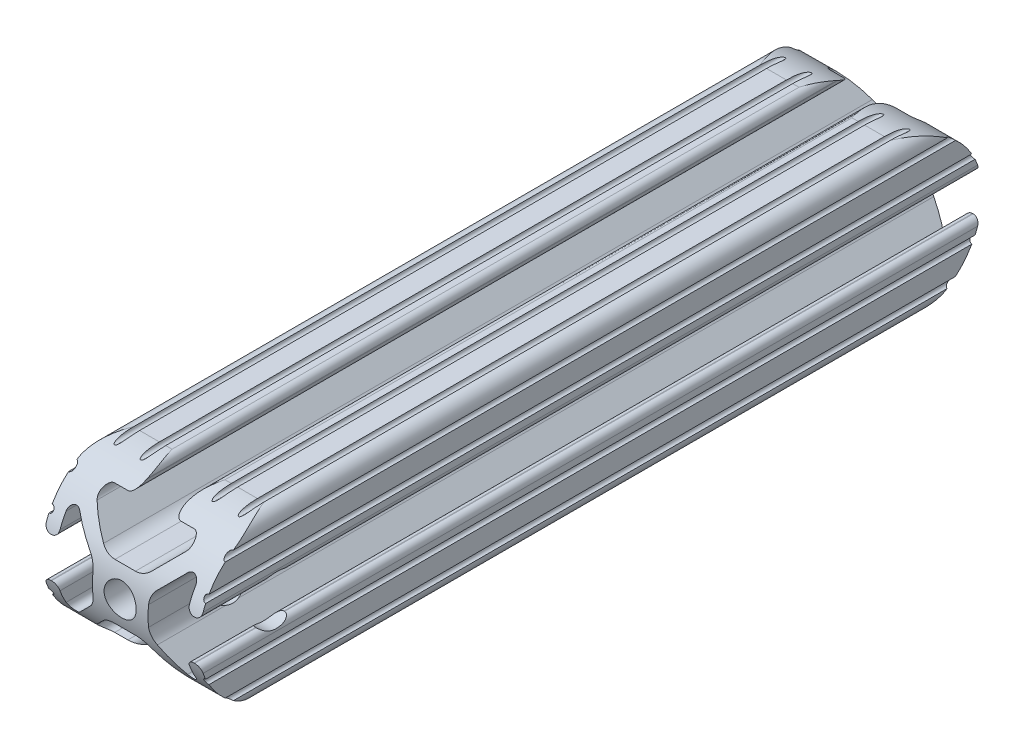
from build123d import *
from build123d.topology import SkipClean

# Parameters (mm, degrees)
SKETCH1_R           = 2.6035
BOSS_EXTRUDE1_DEPTH = 63.5
SKETCH2_R           = 3.96875
CUT_EXTRUDE1_DEPTH  = 70.560764803


with BuildPart() as part:
    # Sketch1 → Boss-Extrude1 (new, symmetric)
    with BuildSketch(Plane.XY):
        with BuildLine():
            Line((-7.179650497, -8.645192506), (-3.952270251, -5.423690499))
            ThreePointArc((-3.952270251, -5.423690499), (-2.922936451, -4.736929036), (-1.709253557, -4.4958))
            Line((-1.709253557, -4.4958), (1.709253557, -4.4958))
            ThreePointArc((1.709253557, -4.4958), (2.922936451, -4.736929036), (3.952270251, -5.423690499))
            Line((3.952270251, -5.423690499), (7.179650497, -8.645192506))
            ThreePointArc((7.179650497, -8.645192506), (7.41473083, -9.822813117), (6.416408329, -10.4902))
            Line((6.416408329, -10.4902), (4.287512407, -10.4902))
            ThreePointArc((4.287512407, -10.4902), (3.54574862, -10.79744862), (3.2385, -11.539212407))
            Line((3.2385, -11.539212407), (3.2385, -11.650987593))
            ThreePointArc((3.2385, -11.650987593), (3.54574862, -12.39275138), (4.287512407, -12.7))
            Line((4.287512407, -12.7), (5.317126718, -12.7))
            ThreePointArc((5.317126718, -12.7), (5.825126718, -12.192), (6.333126718, -12.7))
            Line((6.333126718, -12.7), (9.550443118, -12.7))
            ThreePointArc((9.550443118, -12.7), (10.058366869, -12.192000006), (10.566443095, -12.699847501))
            ThreePointArc((10.566443095, -12.699847501), (12.082537762, -12.08250727), (12.699846982, -10.566399977))
            ThreePointArc((12.699846982, -10.566399977), (12.192000006, -10.058323491), (12.7, -9.5504))
            Line((12.7, -9.5504), (12.7, -6.3330836))
            ThreePointArc((12.7, -6.3330836), (12.192, -5.8250836), (12.7, -5.3170836))
            Line((12.7, -5.3170836), (12.7, -4.287469289))
            ThreePointArc((12.7, -4.287469289), (12.39275138, -3.545705502), (11.650987593, -3.238456882))
            Line((11.650987593, -3.238456882), (11.539212407, -3.238456882))
            ThreePointArc((11.539212407, -3.238456882), (10.79744862, -3.545705502), (10.4902, -4.287469289))
            Line((10.4902, -4.287469289), (10.4902, -6.402089023))
            ThreePointArc((10.4902, -6.402089023), (9.856505071, -7.351067942), (8.737131347, -7.129408934))
            Line((8.737131347, -7.129408934), (5.441005833, -3.840816462))
            ThreePointArc((5.441005833, -3.840816462), (4.750877967, -2.809883091), (4.5085, -1.593185507))
            Line((4.5085, -1.593185507), (4.5085, 1.593185507))
            ThreePointArc((4.5085, 1.593185507), (4.750877967, 2.809883091), (5.441005833, 3.840816462))
            Line((5.441005833, 3.840816462), (8.737131347, 7.129408934))
            ThreePointArc((8.737131347, 7.129408934), (9.856505071, 7.351067942), (10.4902, 6.402089023))
            Line((10.4902, 6.402089023), (10.4902, 4.287469289))
            ThreePointArc((10.4902, 4.287469289), (10.79744862, 3.545705502), (11.539212407, 3.238456882))
            Line((11.539212407, 3.238456882), (11.650987593, 3.238456882))
            ThreePointArc((11.650987593, 3.238456882), (12.39275138, 3.545705502), (12.7, 4.287469289))
            Line((12.7, 4.287469289), (12.7, 5.3170836))
            ThreePointArc((12.7, 5.3170836), (12.192, 5.8250836), (12.7, 6.3330836))
            Line((12.7, 6.3330836), (12.7, 9.5504))
            ThreePointArc((12.7, 9.5504), (12.192000006, 10.058323491), (12.699846982, 10.566399977))
            ThreePointArc((12.699846982, 10.566399977), (12.082537762, 12.08250727), (10.566443095, 12.699847501))
            ThreePointArc((10.566443095, 12.699847501), (10.058366869, 12.192000006), (9.550443118, 12.7))
            Line((9.550443118, 12.7), (6.333126718, 12.7))
            ThreePointArc((6.333126718, 12.7), (5.825126718, 12.192), (5.317126718, 12.7))
            Line((5.317126718, 12.7), (4.287512407, 12.7))
            ThreePointArc((4.287512407, 12.7), (3.54574862, 12.39275138), (3.2385, 11.650987593))
            Line((3.2385, 11.650987593), (3.2385, 11.539212407))
            ThreePointArc((3.2385, 11.539212407), (3.54574862, 10.79744862), (4.287512407, 10.4902))
            Line((4.287512407, 10.4902), (6.476788598, 10.4902))
            ThreePointArc((6.476788598, 10.4902), (7.432222385, 9.85140422), (7.207036008, 8.724370562))
            Line((7.207036008, 8.724370562), (3.898272566, 5.423169045))
            ThreePointArc((3.898272566, 5.423169045), (2.869120213, 4.736787962), (1.655778399, 4.4958))
            Line((1.655778399, 4.4958), (-1.655778399, 4.4958))
            ThreePointArc((-1.655778399, 4.4958), (-2.869120213, 4.736787962), (-3.898272566, 5.423169045))
            Line((-3.898272566, 5.423169045), (-7.207036008, 8.724370562))
            ThreePointArc((-7.207036008, 8.724370562), (-7.432222385, 9.85140422), (-6.476788598, 10.4902))
            Line((-6.476788598, 10.4902), (-4.287512407, 10.4902))
            ThreePointArc((-4.287512407, 10.4902), (-3.54574862, 10.79744862), (-3.2385, 11.539212407))
            Line((-3.2385, 11.539212407), (-3.2385, 11.650987593))
            ThreePointArc((-3.2385, 11.650987593), (-3.54574862, 12.39275138), (-4.287512407, 12.7))
            Line((-4.287512407, 12.7), (-5.317126718, 12.7))
            ThreePointArc((-5.317126718, 12.7), (-5.825126718, 12.192), (-6.333126718, 12.7))
            Line((-6.333126718, 12.7), (-9.550443118, 12.7))
            ThreePointArc((-9.550443118, 12.7), (-10.058366869, 12.192000006), (-10.566443095, 12.699847501))
            ThreePointArc((-10.566443095, 12.699847501), (-12.082537762, 12.08250727), (-12.699846982, 10.566399977))
            ThreePointArc((-12.699846982, 10.566399977), (-12.192000006, 10.058323491), (-12.7, 9.5504))
            Line((-12.7, 9.5504), (-12.7, 6.3330836))
            ThreePointArc((-12.7, 6.3330836), (-12.192, 5.8250836), (-12.7, 5.3170836))
            Line((-12.7, 5.3170836), (-12.7, 4.287469289))
            ThreePointArc((-12.7, 4.287469289), (-12.39275138, 3.545705502), (-11.650987593, 3.238456882))
            Line((-11.650987593, 3.238456882), (-11.539212407, 3.238456882))
            ThreePointArc((-11.539212407, 3.238456882), (-10.79744862, 3.545705502), (-10.4902, 4.287469289))
            Line((-10.4902, 4.287469289), (-10.4902, 6.402089023))
            ThreePointArc((-10.4902, 6.402089023), (-9.856505071, 7.351067942), (-8.737131347, 7.129408934))
            Line((-8.737131347, 7.129408934), (-5.441005833, 3.840816462))
            ThreePointArc((-5.441005833, 3.840816462), (-4.750877967, 2.809883091), (-4.5085, 1.593185507))
            Line((-4.5085, 1.593185507), (-4.5085, -1.593185507))
            ThreePointArc((-4.5085, -1.593185507), (-4.750877967, -2.809883091), (-5.441005833, -3.840816462))
            Line((-5.441005833, -3.840816462), (-8.737131347, -7.129408934))
            ThreePointArc((-8.737131347, -7.129408934), (-9.856505071, -7.351067942), (-10.4902, -6.402089023))
            Line((-10.4902, -6.402089023), (-10.4902, -4.287469289))
            ThreePointArc((-10.4902, -4.287469289), (-10.79744862, -3.545705502), (-11.539212407, -3.238456882))
            Line((-11.539212407, -3.238456882), (-11.650987593, -3.238456882))
            ThreePointArc((-11.650987593, -3.238456882), (-12.39275138, -3.545705502), (-12.7, -4.287469289))
            Line((-12.7, -4.287469289), (-12.7, -5.3170836))
            ThreePointArc((-12.7, -5.3170836), (-12.192, -5.8250836), (-12.7, -6.3330836))
            Line((-12.7, -6.3330836), (-12.7, -9.5504))
            ThreePointArc((-12.7, -9.5504), (-12.192000006, -10.058323491), (-12.699846982, -10.566399977))
            ThreePointArc((-12.699846982, -10.566399977), (-12.082537762, -12.08250727), (-10.566443095, -12.699847501))
            ThreePointArc((-10.566443095, -12.699847501), (-10.058366869, -12.192000006), (-9.550443118, -12.7))
            Line((-9.550443118, -12.7), (-6.333126718, -12.7))
            ThreePointArc((-6.333126718, -12.7), (-5.825126718, -12.192), (-5.317126718, -12.7))
            Line((-5.317126718, -12.7), (-4.287512407, -12.7))
            ThreePointArc((-4.287512407, -12.7), (-3.54574862, -12.39275138), (-3.2385, -11.650987593))
            Line((-3.2385, -11.650987593), (-3.2385, -11.539212407))
            ThreePointArc((-3.2385, -11.539212407), (-3.54574862, -10.79744862), (-4.287512407, -10.4902))
            Line((-4.287512407, -10.4902), (-6.416408329, -10.4902))
            ThreePointArc((-6.416408329, -10.4902), (-7.41473083, -9.822813117), (-7.179650497, -8.645192506))
        make_face()
        Circle(SKETCH1_R, mode=Mode.SUBTRACT)
    extrude(amount=BOSS_EXTRUDE1_DEPTH, both=True)

    # Sketch2 → Cut-Extrude1 (cut, through all)
    with SkipClean():  # the faces are left unmerged after this step: merging them gives an invalid solid
        with BuildSketch(Plane(origin=(12.7, 0, 0), x_dir=(0, 0, -1), z_dir=(1, 0, 0))):
            with BuildLine():
                Line((50.8, -12.7), (63.5, -12.7))
                Line((63.5, -12.7), (63.5, 0))
                ThreePointArc((63.5, 0), (59.780256121, -8.980256121), (50.8, -12.7))
            make_face()
            with BuildLine():
                Line((-63.5, -12.7), (-50.79999997, -12.7))
                ThreePointArc((-50.79999997, -12.7), (-59.78025611, -8.980256132), (-63.5, 0))
                Line((-63.5, 0), (-63.5, -12.7))
            make_face()
            with BuildLine():
                ThreePointArc((50.8, 12.7), (59.780256121, 8.980256121), (63.5, 0))
                Line((63.5, 0), (63.5, 12.7))
                Line((63.5, 12.7), (50.8, 12.7))
            make_face()
            with BuildLine():
                Line((-63.5, 12.7), (-63.5, 0))
                ThreePointArc((-63.5, 0), (-59.780256121, 8.980256121), (-50.8, 12.7))
                Line((-50.8, 12.7), (-63.5, 12.7))
            make_face()
            with Locations((-50.8, 0)):
                Circle(SKETCH2_R)
        extrude(amount=-CUT_EXTRUDE1_DEPTH, mode=Mode.SUBTRACT)


solid = part.part
